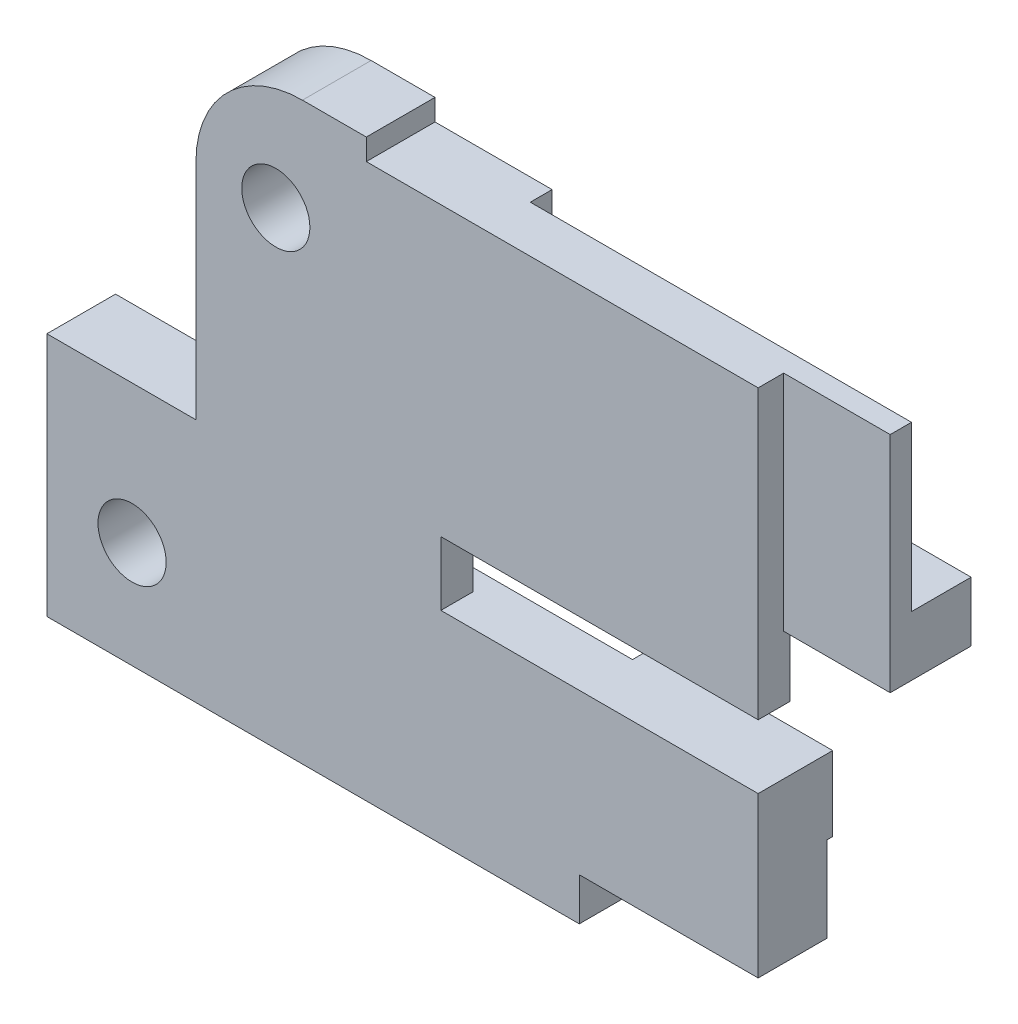
from build123d import *
from build123d.topology import SkipClean

# Parameters (mm, degrees)
SKETCH_1_W           = 10
SKETCH_1_H           = 11.5
SKETCH_1_R           = 1.6
EXTRUDE_1_DEPTH      = 3
SKETCH_2_W           = 15
SKETCH_2_H           = 6
EXTRUDE_2_DEPTH      = 5
FILLET_1_R           = 1
SKETCH_3_W           = 5
SKETCH_3_H           = 5
EXTRUDE_3_DEPTH      = 2
SKETCH_4_W           = 5
SKETCH_4_H           = 3
EXTRUDE_4_DEPTH      = 19.5
SKETCH_5_W           = 5
SKETCH_5_H           = 3.5
EXTRUDE_5_DEPTH      = 3
SKETCH_6_W           = 3
SKETCH_6_H           = 8.5
EXTRUDE_6_DEPTH      = 3
EXTRUDE_7_DEPTH      = 1
SKETCH_8_W           = 3.5
SKETCH_8_H           = 21.5
EXTRUDE_8_DEPTH      = 1
SKETCH_9_W           = 3
SKETCH_9_H           = 8
EXTRUDE_9_DEPTH      = 3.5
EXTRUDE_10_REACH     = 29.208
SKETCH_10_W          = 2.5
SKETCH_10_H          = 3.5
EXTRUDE_11_REACH     = 29.208
SKETCH_11_W          = 3
SKETCH_11_H          = 4
SKETCH_12_W          = 1.5
SKETCH_12_H          = 1.2
CUT_EXTRUDE_1_DEPTH  = 2
SKETCH_13_W          = 1
SKETCH_13_H          = 2.5
EXTRUDE_12_DEPTH     = 6.5
SKETCH_14_W          = 1.2
SKETCH_14_H          = 8
EXTRUDE_13_DEPTH     = 6.5
SKETCH_15_W          = 4
SKETCH_15_H          = 4
EXTRUDE_14_DEPTH     = 2.8
FILLET_2_R           = 1
CUT_EXTRUDE_2_REACH  = 33.357
SKETCH_16_R          = 1.6
SKETCH_17_W          = 15
SKETCH_17_H          = 5
EXTRUDE_15_DEPTH     = 2
EXTRUDE_16_DEPTH     = 5.5
SKETCH_19_W          = 2
SKETCH_19_H          = 2.8
EXTRUDE_17_DEPTH     = 2
EXTRUDE_18_DEPTH     = 5.5
EXTRUDE_19_DEPTH     = 2.9
EXTRUDE_20_DEPTH     = 0.5
SKETCH_23_W          = 14.9
SKETCH_23_H          = 1.5
EXTRUDE_21_DEPTH     = 0.5
SKETCH_24_W          = 3
SKETCH_24_H          = 2.8
EXTRUDE_22_DEPTH     = 5
EXTRUDE_23_DEPTH     = 3.2
SKETCH_26_W          = 10
SKETCH_26_H          = 1.8
EXTRUDE_24_DEPTH     = 3
SKETCH_27_W          = 10
SKETCH_27_H          = 1.8
EXTRUDE_25_DEPTH     = 1
SKETCH_28_W          = 11.5
SKETCH_28_H          = 12.2
CUT_EXTRUDE_3_DEPTH  = 0.775
CUT_EXTRUDE_4_DEPTH  = 0.5
SKETCH_30_W          = 3
SKETCH_30_H          = 7.5
EXTRUDE_26_DEPTH     = 3.5
EXTRUDE_START        = 0.225
SKETCH_31_R          = 1.6
EXTRUDE_27_DEPTH     = 0.225
CUT_EXTRUDE_5_DEPTH  = 1.775
SKETCH_33_W          = 4
SKETCH_33_H          = 3.2
CUT_EXTRUDE_6_DEPTH  = 2.8
SKETCH_34_W          = 2.025
SKETCH_34_H          = 9.4
EXTRUDE_28_DEPTH     = 2
SKETCH_35_W          = 0.775
SKETCH_35_H          = 1.8
CUT_EXTRUDE_7_DEPTH  = 2
CUT_EXTRUDE_8_REACH  = 45.061
SKETCH_36_W          = 19.5
SKETCH_36_H          = 3.2
CUT_EXTRUDE_9_REACH  = 38.357
SKETCH_37_W          = 3.225
SKETCH_37_H          = 2
CUT_EXTRUDE_10_REACH = 43.54
SKETCH_39_W          = 26.4
SKETCH_39_H          = 1.5
SKETCH_40_W          = 1
SKETCH_40_H          = 3.225
EXTRUDE_29_DEPTH     = 11.5
EXTRUDE_30_REACH     = 45.87
SKETCH_41_W          = 1
SKETCH_41_H          = 10.5
SKETCH_42_W          = 1
SKETCH_42_H          = 7.5
EXTRUDE_31_DEPTH     = 3
SKETCH_43_W          = 8
SKETCH_43_H          = 3.225
EXTRUDE_32_DEPTH     = 1
CUT_EXTRUDE_11_REACH = 43.007
SKETCH_44_W          = 3
SKETCH_44_H          = 7.5
FILLET_3_R           = 5


with BuildPart() as part:
    # 草图1 → 凸台-拉伸1 (new body)
    with BuildSketch(Plane.XY):
        with Locations((1, 0.75)):
            Rectangle(SKETCH_1_W, SKETCH_1_H)
        Circle(SKETCH_1_R, mode=Mode.SUBTRACT)
    extrude(amount=EXTRUDE_1_DEPTH)

    # 草图2 → 凸台-拉伸2 (add)
    with BuildSketch(Plane.XY.offset(3)):
        with Locations((13.5, -2)):
            Rectangle(SKETCH_2_W, SKETCH_2_H)
    extrude(amount=-EXTRUDE_2_DEPTH)

    # 圆角1
    fillet_1_edges = [part.edges().sort_by_distance(p)[0] for p in [
        (-4, 0.75, 0),
    ]]
    fillet(fillet_1_edges, radius=FILLET_1_R)

    # 草图3 → 凸台-拉伸3 (add)
    with BuildSketch(Plane(origin=(0, 1, 0), x_dir=(1, 0, 0), z_dir=(0, 1, 0))):
        with Locations((8.5, -0.5)):
            Rectangle(SKETCH_3_W, SKETCH_3_H)
    extrude(amount=EXTRUDE_3_DEPTH)

    # 草图4 → 凸台-拉伸4 (add)
    with BuildSketch(Plane(origin=(0, 3, 0), x_dir=(1, 0, 0), z_dir=(0, 1, 0))):
        with Locations((8.5, -1.5)):
            Rectangle(SKETCH_4_W, SKETCH_4_H)
    extrude(amount=EXTRUDE_4_DEPTH)

    # 草图5 → 凸台-拉伸5 (add)
    with BuildSketch(Plane(origin=(0, 0, 0), x_dir=(-1, 0, 0), z_dir=(0, 0, -1))):
        with Locations((-8.5, 11.75)):
            Rectangle(SKETCH_5_W, SKETCH_5_H)
    extrude(amount=EXTRUDE_5_DEPTH)

    # 草图6 → 凸台-拉伸6 (add)
    with BuildSketch(Plane.ZY.offset(-6)):
        with Locations((1.5, 18.25)):
            Rectangle(SKETCH_6_W, SKETCH_6_H)
    extrude(amount=EXTRUDE_6_DEPTH)

    # 草图7 → 凸台-拉伸7 (add)
    with BuildSketch(Plane(origin=(0, 0, 0), x_dir=(-1, 0, 0), z_dir=(0, 0, -1))):
        Polygon((-11, 13.5), (-6, 13.5), (-6, 14), (-3, 14), (-3, 22.5), (-11, 22.5), align=None)
    extrude(amount=EXTRUDE_7_DEPTH)

    # 草图8 → 凸台-拉伸8 (add)
    with BuildSketch(Plane.XY.offset(3)):
        with Locations((12.75, 11.75)):
            Rectangle(SKETCH_8_W, SKETCH_8_H)
    extrude(amount=-EXTRUDE_8_DEPTH)

    # 草图9 → 凸台-拉伸9 (add)
    with BuildSketch(Plane(origin=(11, 0, 0), x_dir=(0, 0, -1), z_dir=(1, 0, 0))):
        with Locations((-0.5, 18.5)):
            Rectangle(SKETCH_9_W, SKETCH_9_H)
    extrude(amount=EXTRUDE_9_DEPTH)

    # 凸台-拉伸10: up to this face of the body (flat: up to its plane)
    extrude_10_end = Plane(part.part.faces().sort_by_distance((21, -2, 0.5))[0])
    # 草图10 → 凸台-拉伸10 (add, up to the picked face)
    with BuildSketch(Plane(origin=(11, 0, 0), x_dir=(0, 0, -1), z_dir=(1, 0, 0)), mode=Mode.PRIVATE) as extrude_10_sk1:
        with Locations((-1.75, 2.75)):
            Rectangle(SKETCH_10_W, SKETCH_10_H)
    extrude_10_tool1 = split(extrude(extrude_10_sk1.sketch, amount=EXTRUDE_10_REACH, mode=Mode.PRIVATE), bisect_by=extrude_10_end, keep=Keep.BOTH, mode=Mode.PRIVATE)
    add(extrude_10_tool1.solids().sort_by(Axis((11, 2.75, 1.75), (1, 0, 0)))[0])

    # 凸台-拉伸11: up to this face of the body (flat: up to its plane)
    extrude_11_end = Plane(part.part.faces().sort_by_distance((21, -0.927419355, 0.782258065))[0])
    # 草图11 → 凸台-拉伸11 (add, up to the picked face)
    with BuildSketch(Plane(origin=(11, 0, 0), x_dir=(0, 0, -1), z_dir=(1, 0, 0)), mode=Mode.PRIVATE) as extrude_11_sk1:
        with Locations((-1.5, 12.5)):
            Rectangle(SKETCH_11_W, SKETCH_11_H)
    extrude_11_tool1 = split(extrude(extrude_11_sk1.sketch, amount=EXTRUDE_11_REACH, mode=Mode.PRIVATE), bisect_by=extrude_11_end, keep=Keep.BOTH, mode=Mode.PRIVATE)
    add(extrude_11_tool1.solids().sort_by(Axis((11, 12.5, 1.5), (1, 0, 0)))[0])

    # 草图12 → 切除-拉伸1 (cut)
    with BuildSketch(Plane(origin=(21, 0, 0), x_dir=(0, 0, -1), z_dir=(1, 0, 0))):
        with Locations((-0.75, 13.9)):
            Rectangle(SKETCH_12_W, SKETCH_12_H)
    extrude(amount=-CUT_EXTRUDE_1_DEPTH, mode=Mode.SUBTRACT)

    # 草图13 → 凸台-拉伸12 (add)
    with BuildSketch(Plane(origin=(14.5, 0, 0), x_dir=(0, 0, -1), z_dir=(1, 0, 0))):
        with Locations((-2.5, 9.25)):
            Rectangle(SKETCH_13_W, SKETCH_13_H)
    extrude(amount=EXTRUDE_12_DEPTH)

    # 草图14 → 凸台-拉伸13 (add)
    with BuildSketch(Plane(origin=(14.5, 0, 0), x_dir=(0, 0, -1), z_dir=(1, 0, 0))):
        with Locations((-2.4, 18.5)):
            Rectangle(SKETCH_14_W, SKETCH_14_H)
    extrude(amount=EXTRUDE_13_DEPTH)

    # 草图15 → 凸台-拉伸14 (add)
    with BuildSketch(Plane(origin=(0, 0, 1.8), x_dir=(-1, 0, 0), z_dir=(0, 0, -1))):
        with Locations((-16.5, 16.5)):
            Rectangle(SKETCH_15_W, SKETCH_15_H)
    extrude(amount=EXTRUDE_14_DEPTH)

    # 圆角2
    fillet_2_edges = [part.edges().sort_by_distance(p)[0] for p in [
        (14.5, 18.5, 0.4),
    ]]
    fillet(fillet_2_edges, radius=FILLET_2_R)

    # 草图16 → 切除-拉伸2 (cut, up to next)
    with BuildSketch(Plane.XY.offset(3), mode=Mode.PRIVATE) as cut_extrude_2_sk1:
        with Locations((6.75, 17)):
            Circle(SKETCH_16_R)
    cut_extrude_2_tool1 = extrude(cut_extrude_2_sk1.sketch, amount=-CUT_EXTRUDE_2_REACH, mode=Mode.PRIVATE) & part.part
    add(cut_extrude_2_tool1.solids().sort_by_distance((6.75, 17, 3))[0], mode=Mode.SUBTRACT)

    # 草图17 → 凸台-拉伸15 (add)
    with BuildSketch(Plane.XZ.offset(5)):
        with Locations((13.5, 0.5)):
            Rectangle(SKETCH_17_W, SKETCH_17_H)
    extrude(amount=EXTRUDE_15_DEPTH)

    # 草图18 → 凸台-拉伸16 (add)
    with BuildSketch(Plane(origin=(21, 0, 0), x_dir=(0, 0, -1), z_dir=(1, 0, 0))):
        Polygon((0, 13.3), (-1.5, 13.3), (-1.5, 14.5), (-1.8, 14.5), (-1.8, 22.5), (-3, 22.5), (-3, 8), (-2, 8), (-2, 10.5), (0, 10.5), align=None)
    extrude(amount=EXTRUDE_16_DEPTH)

    # 草图19 → 凸台-拉伸17 (add)
    with BuildSketch(Plane(origin=(0, 0, 0), x_dir=(-1, 0, 0), z_dir=(0, 0, -1))):
        with Locations((-25.5, 11.9)):
            Rectangle(SKETCH_19_W, SKETCH_19_H)
    extrude(amount=EXTRUDE_17_DEPTH)

    # 草图20 → 凸台-拉伸18 (add)
    with BuildSketch(Plane(origin=(21, 0, 0), x_dir=(0, 0, -1), z_dir=(1, 0, 0))):
        Polygon((0.5, -3), (-3, -3), (-3, 4.5), (0.5, 4.5), (0.5, 1), (2, 1), (2, -3), align=None)
    extrude(amount=EXTRUDE_18_DEPTH)

    # 草图21 → 凸台-拉伸19 (add)
    with BuildSketch(Plane(origin=(26.5, 0, 0), x_dir=(0, 0, -1), z_dir=(1, 0, 0))):
        Polygon((-3, -3), (2, -3), (2, 1), (0.5, 1), (0.5, 4.5), (-3, 4.5), align=None)
        Polygon((-2, 10.5), (2, 10.5), (2, 13.3), (-1.5, 13.3), (-1.5, 14.5), (-1.8, 14.5), (-1.8, 22.5), (-3, 22.5), (-3, 8), (-2, 8), align=None)
    extrude(amount=EXTRUDE_19_DEPTH)

    # 草图22 → 凸台-拉伸20 (add)
    with BuildSketch(Plane(origin=(0, 0, 2), x_dir=(-1, 0, 0), z_dir=(0, 0, -1))):
        Polygon((-11, 10.5), (-29.4, 10.5), (-29.4, 8), (-14.5, 8), (-14.5, 4.5), (-11, 4.5), align=None)
    extrude(amount=EXTRUDE_20_DEPTH)

    # 草图23 → 凸台-拉伸21 (add)
    with BuildSketch(Plane.XZ.offset(-8)):
        with Locations((21.95, 2.25)):
            Rectangle(SKETCH_23_W, SKETCH_23_H)
    extrude(amount=EXTRUDE_21_DEPTH)

    # 草图24 → 凸台-拉伸22 (add)
    with BuildSketch(Plane(origin=(29.4, 0, 0), x_dir=(0, 0, -1), z_dir=(1, 0, 0))):
        with Locations((0.5, 11.9)):
            Rectangle(SKETCH_24_W, SKETCH_24_H)
    extrude(amount=EXTRUDE_22_DEPTH)

    # 草图25 → 凸台-拉伸23 (add)
    with BuildSketch(Plane(origin=(0, 22.5, 0), x_dir=(1, 0, 0), z_dir=(0, 1, 0))):
        Polygon((9.9, 1), (9.9, -3), (29.4, -3), (29.4, -1.8), (14.5, -1.8), (14.5, 1), align=None)
    extrude(amount=EXTRUDE_23_DEPTH)

    # 草图26 → 凸台-拉伸24 (add)
    with BuildSketch(Plane(origin=(0, 13.3, 0), x_dir=(1, 0, 0), z_dir=(0, 1, 0))):
        with Locations((23.5, -0.9)):
            Rectangle(SKETCH_26_W, SKETCH_26_H)
    extrude(amount=EXTRUDE_24_DEPTH)

    # 草图27 → 凸台-拉伸25 (add)
    with BuildSketch(Plane(origin=(0, 0, 0), x_dir=(-1, 0, 0), z_dir=(0, 0, -1))):
        with Locations((-23.5, 15.4)):
            Rectangle(SKETCH_27_W, SKETCH_27_H)
    extrude(amount=EXTRUDE_25_DEPTH)

    # 草图28 → 切除-拉伸3 (cut)
    with BuildSketch(Plane(origin=(0, 0, -1), x_dir=(-1, 0, 0), z_dir=(0, 0, -1))):
        with Locations((-8.75, 19.6)):
            Rectangle(SKETCH_28_W, SKETCH_28_H)
    extrude(amount=-CUT_EXTRUDE_3_DEPTH, mode=Mode.SUBTRACT)

    # 草图29 → 切除-拉伸4 (cut)
    with BuildSketch(Plane.ZY.offset(-6)):
        Polygon((3, 14), (-0.225, 14), (-0.225, 13.5), (-3, 13.5), (-3, 10), (0, 10), (0, 6.5), (3, 6.5), align=None)
    extrude(amount=-CUT_EXTRUDE_4_DEPTH, mode=Mode.SUBTRACT)

    # 草图30 → 凸台-拉伸26 (add)
    with BuildSketch(Plane.ZY.offset(-6.5)):
        with Locations((1.5, 10.25)):
            Rectangle(SKETCH_30_W, SKETCH_30_H)
    extrude(amount=EXTRUDE_26_DEPTH)

    # 草图31 → 凸台-拉伸27 (add)
    with SkipClean():  # the faces are left unmerged after this step: merging them gives an invalid solid
        with BuildSketch(Plane(origin=(0, 0, 0), x_dir=(-1, 0, 0), z_dir=(0, 0, -1)).offset(EXTRUDE_START)):
            Polygon((3, 6.5), (-3, 6.5), (-3, 14), (-6.5, 14), (-6.5, 10), (-11, 10), (-11, 3), (-6, 3), (-6, -5), (3, -5), align=None)
            Circle(SKETCH_31_R, mode=Mode.SUBTRACT)
        extrude(amount=-EXTRUDE_27_DEPTH)

    # 草图32 → 切除-拉伸5 (cut)
    with SkipClean():  # the faces are left unmerged after this step: merging them gives an invalid solid
        with BuildSketch(Plane(origin=(0, 0, -2), x_dir=(-1, 0, 0), z_dir=(0, 0, -1))):
            Polygon((-6, -7), (-6, 3), (-11, 3), (-11, 1), (-29.4, 1), (-29.4, -3), (-21, -3), (-21, -7), align=None)
        extrude(amount=-CUT_EXTRUDE_5_DEPTH, mode=Mode.SUBTRACT)

    # 草图33 → 切除-拉伸6 (cut)
    with SkipClean():  # the faces are left unmerged after this step: merging them gives an invalid solid
        with BuildSketch(Plane(origin=(0, 0, 1.8), x_dir=(-1, 0, 0), z_dir=(0, 0, -1))):
            with Locations((-16.5, 17.9)):
                Rectangle(SKETCH_33_W, SKETCH_33_H)
        extrude(amount=CUT_EXTRUDE_6_DEPTH, mode=Mode.SUBTRACT)

    # 草图34 → 凸台-拉伸28 (add)
    with SkipClean():  # the faces are left unmerged after this step: merging them gives an invalid solid
        with BuildSketch(Plane(origin=(14.5, 0, 0), x_dir=(0, 0, -1), z_dir=(1, 0, 0))):
            with Locations((-0.7875, 21)):
                Rectangle(SKETCH_34_W, SKETCH_34_H)
        extrude(amount=EXTRUDE_28_DEPTH)

    # 草图35 → 切除-拉伸7 (cut)
    with SkipClean():  # the faces are left unmerged after this step: merging them gives an invalid solid
        with BuildSketch(Plane.ZY.offset(-14.5)):
            with Locations((-0.6125, 15.4)):
                Rectangle(SKETCH_35_W, SKETCH_35_H)
        extrude(amount=-CUT_EXTRUDE_7_DEPTH, mode=Mode.SUBTRACT)

    # 草图36 → 切除-拉伸8 (cut, up to next)
    with BuildSketch(Plane(origin=(0, 0, -0.225), x_dir=(-1, 0, 0), z_dir=(0, 0, -1)), mode=Mode.PRIVATE) as cut_extrude_8_sk1:
        with Locations((-19.65, 24.1)):
            Rectangle(SKETCH_36_W, SKETCH_36_H)
    cut_extrude_8_tool1 = extrude(cut_extrude_8_sk1.sketch, amount=-CUT_EXTRUDE_8_REACH, mode=Mode.PRIVATE) & part.part
    add(cut_extrude_8_tool1.solids().sort_by_distance((19.65, 24.1, -0.225))[0], mode=Mode.SUBTRACT)

    # 草图37 → 切除-拉伸9 (cut, up to next)
    with BuildSketch(Plane.ZY.offset(-6), mode=Mode.PRIVATE) as cut_extrude_9_sk1:
        with Locations((1.3875, -6)):
            Rectangle(SKETCH_37_W, SKETCH_37_H)
    cut_extrude_9_tool1 = extrude(cut_extrude_9_sk1.sketch, amount=-CUT_EXTRUDE_9_REACH, mode=Mode.PRIVATE) & part.part
    add(cut_extrude_9_tool1.solids().sort_by_distance((6, -6, 1.3875))[0], mode=Mode.SUBTRACT)

    # 草图39 → 切除-拉伸10 (cut, up to next)
    with BuildSketch(Plane.XY.offset(3), mode=Mode.PRIVATE) as cut_extrude_10_sk1:
        with Locations((16.2, 21.75)):
            Rectangle(SKETCH_39_W, SKETCH_39_H)
    cut_extrude_10_tool1 = extrude(cut_extrude_10_sk1.sketch, amount=-CUT_EXTRUDE_10_REACH, mode=Mode.PRIVATE) & part.part
    add(cut_extrude_10_tool1.solids().sort_by_distance((16.2, 21.75, 3))[0], mode=Mode.SUBTRACT)

    # 草图40 → 凸台-拉伸29 (add)
    with SkipClean():  # the faces are left unmerged after this step: merging them gives an invalid solid
        with BuildSketch(Plane(origin=(0, 6.5, 0), x_dir=(1, 0, 0), z_dir=(0, 1, 0))):
            with Locations((-3.5, -1.3875)):
                Rectangle(SKETCH_40_W, SKETCH_40_H)
        extrude(amount=-EXTRUDE_29_DEPTH)

    # 草图41 → 凸台-拉伸30 (add, up to next)
    with BuildSketch(Plane(origin=(34.4, 0, 0), x_dir=(0, 0, -1), z_dir=(1, 0, 0)), mode=Mode.PRIVATE) as extrude_30_sk1:
        with Locations((-1.3, 15.75)):
            Rectangle(SKETCH_41_W, SKETCH_41_H)
    extrude_30_tool1 = extrude(extrude_30_sk1.sketch, amount=-EXTRUDE_30_REACH, mode=Mode.PRIVATE) - part.part
    add(extrude_30_tool1.solids().sort_by_distance((34.4, 15.75, 1.3))[0])

    # 草图42 → 凸台-拉伸31 (add)
    with SkipClean():  # the faces are left unmerged after this step: merging them gives an invalid solid
        with BuildSketch(Plane(origin=(29.4, 0, 0), x_dir=(0, 0, -1), z_dir=(1, 0, 0))):
            with Locations((-0.275, 0.75)):
                Rectangle(SKETCH_42_W, SKETCH_42_H)
        extrude(amount=EXTRUDE_31_DEPTH)

    # 草图43 → 凸台-拉伸32 (add)
    with SkipClean():  # the faces are left unmerged after this step: merging them gives an invalid solid
        with BuildSketch(Plane(origin=(0, 21, 0), x_dir=(1, 0, 0), z_dir=(0, 1, 0))):
            with Locations((7, -1.3875)):
                Rectangle(SKETCH_43_W, SKETCH_43_H)
        extrude(amount=EXTRUDE_32_DEPTH)

    # 草图44 → 切除-拉伸11 (cut, up to next)
    with BuildSketch(Plane.XY.offset(0.775), mode=Mode.PRIVATE) as cut_extrude_11_sk1:
        with Locations((30.9, 0.75)):
            Rectangle(SKETCH_44_W, SKETCH_44_H)
    cut_extrude_11_tool1 = extrude(cut_extrude_11_sk1.sketch, amount=-CUT_EXTRUDE_11_REACH, mode=Mode.PRIVATE) & part.part
    add(cut_extrude_11_tool1.solids().sort_by_distance((30.9, 0.75, 0.775))[0], mode=Mode.SUBTRACT)

    # 圆角3
    # the kernel refuses this fillet: 5 mm, written as the material it takes off along each edge
    with BuildSketch(Plane(origin=(3, 22, -12.725), x_dir=(1, 0, 0), z_dir=(0, 0, 1))) as fillet_3_piece_1:
        with BuildLine():
            CenterArc((FILLET_3_R, -FILLET_3_R), FILLET_3_R, 90, 90)
            Line((0, -FILLET_3_R), (0, 0))
            Line((0, 0), (FILLET_3_R, 0))
        make_face()
    extrude(amount=28.225, mode=Mode.SUBTRACT)


solid = part.part
